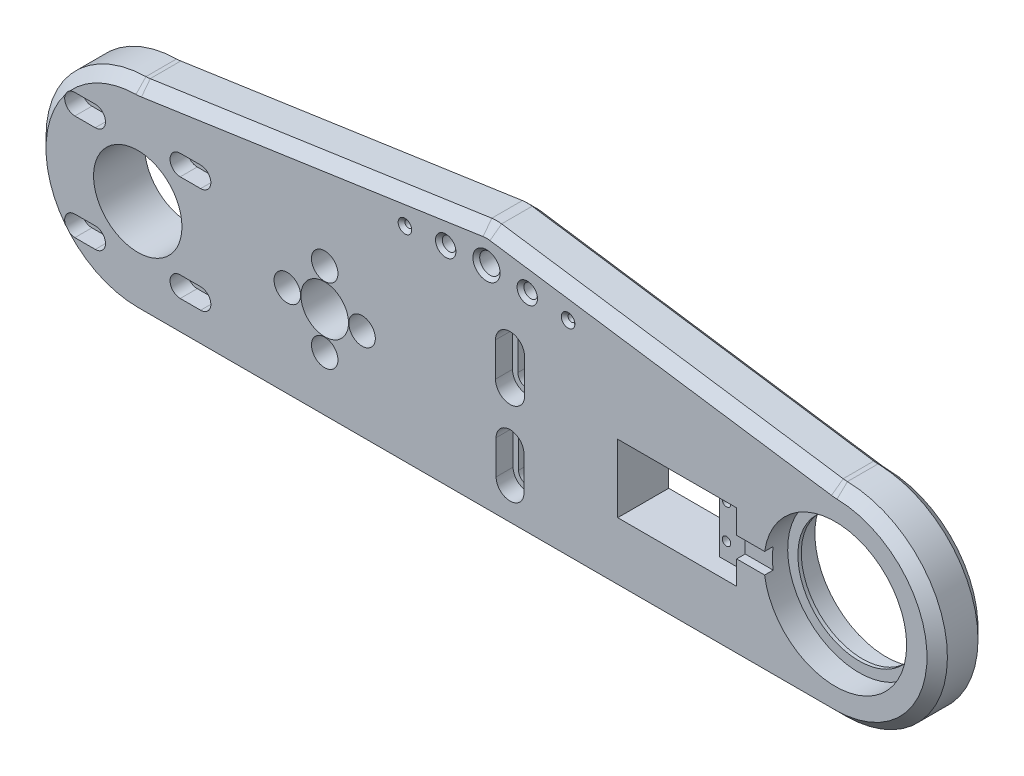
from build123d import *

# Parameters (mm, degrees)
SKETCH3_R                = 2.25
SKETCH3_R_2              = 7
SKETCH3_R_3              = 13
SKETCH3_R_4              = 21
SKETCH3_W                = 35
SKETCH3_H                = 20
BOSS_EXTRUDE1_DEPTH      = 7.5
SKETCH4_R                = 21
SKETCH4_R_2              = 18
BOSS_EXTRUDE2_DEPTH      = 0.5
SKETCH5_W                = 10
SKETCH5_H                = 20
SKETCH5_R                = 1.25
BOSS_EXTRUDE3_DEPTH      = 2.5
SKETCH6_R                = 3
SKETCH6_R_2              = 2
SKETCH6_R_3              = 4
BOSS_EXTRUDE4_DEPTH      = 7.5
FILLET1_R                = 10
SKETCH7_R                = 2
SKETCH7_R_2              = 3
SKETCH7_R_3              = 4
CUT_EXTRUDE1_DEPTH       = 1
CHAMFER1_SIZE            = 1
CHAMFER1_OF_MIRROR1_SIZE = 1
CHAMFER2_SIZE            = 3
CUT_EXTRUDE2_DEPTH       = 240.935187209
SKETCH10_R               = 3
SKETCH10_R_2             = 2
SKETCH10_R_3             = 1
CUT_EXTRUDE3_DEPTH       = 240.935187209
CUT_EXTRUDE4_DEPTH       = 5
CUT_EXTRUDE5_START       = -5
CUT_EXTRUDE5_DEPTH       = 5
SKETCH21_R               = 3.9
CUT_EXTRUDE6_DEPTH       = 6
CUT_EXTRUDE7_START       = -6
SKETCH22_R               = 3.9
CUT_EXTRUDE7_DEPTH       = 6
CUT_EXTRUDE10_DEPTH      = 5
CUT_EXTRUDE11_START      = -5
CUT_EXTRUDE11_DEPTH      = 5
SKETCH27_R               = 2.59
CUT_EXTRUDE13_DEPTH      = 3
SKETCH28_W               = 9
SKETCH28_H               = 6
CUT_EXTRUDE14_DEPTH      = 2.5


with BuildPart() as part:
    # Sketch3 → Boss-Extrude1 (new, symmetric)
    with BuildSketch(Plane.XY):
        with BuildLine():
            Line((0, -30), (205.22, -30))
            ThreePointArc((205.22, -30), (235.22, 0), (205.22, 30))
            Line((205.22, 30), (0, 30))
            ThreePointArc((0, 30), (-30, 0), (0, -30))
        make_face()
        with Locations((55, -11)):
            Circle(SKETCH3_R, mode=Mode.SUBTRACT)
        with Locations((66, 0)):
            Circle(SKETCH3_R, mode=Mode.SUBTRACT)
        with Locations((44, 0)):
            Circle(SKETCH3_R, mode=Mode.SUBTRACT)
        with Locations((55, 0)):
            Circle(SKETCH3_R_2, mode=Mode.SUBTRACT)
        with Locations((55, 11)):
            Circle(SKETCH3_R, mode=Mode.SUBTRACT)
        Circle(SKETCH3_R_3, mode=Mode.SUBTRACT)
        with Locations((205.22, 0)):
            Circle(SKETCH3_R_4, mode=Mode.SUBTRACT)
        with Locations((158.72, 0)):
            Rectangle(SKETCH3_W, SKETCH3_H, mode=Mode.SUBTRACT)
        with BuildLine():
            Line((-18.5, 17.3), (-12.5, 17.3))
            ThreePointArc((-12.5, 17.3), (-10.7, 15.5), (-12.5, 13.7))
            Line((-12.5, 13.7), (-18.5, 13.7))
            ThreePointArc((-18.5, 13.7), (-20.3, 15.5), (-18.5, 17.3))
        make_face(mode=Mode.SUBTRACT)
        with BuildLine():
            Line((12.5, 17.3), (18.5, 17.3))
            ThreePointArc((18.5, 17.3), (20.3, 15.5), (18.5, 13.7))
            Line((18.5, 13.7), (12.5, 13.7))
            ThreePointArc((12.5, 13.7), (10.7, 15.5), (12.5, 17.3))
        make_face(mode=Mode.SUBTRACT)
        with BuildLine():
            Line((-18.5, -13.7), (-12.5, -13.7))
            ThreePointArc((-12.5, -13.7), (-10.7, -15.5), (-12.5, -17.3))
            Line((-12.5, -17.3), (-18.5, -17.3))
            ThreePointArc((-18.5, -17.3), (-20.3, -15.5), (-18.5, -13.7))
        make_face(mode=Mode.SUBTRACT)
        with BuildLine():
            Line((12.5, -13.7), (18.5, -13.7))
            ThreePointArc((18.5, -13.7), (20.3, -15.5), (18.5, -17.3))
            Line((18.5, -17.3), (12.5, -17.3))
            ThreePointArc((12.5, -17.3), (10.7, -15.5), (12.5, -13.7))
        make_face(mode=Mode.SUBTRACT)
    extrude(amount=BOSS_EXTRUDE1_DEPTH, both=True)

    # Sketch4 → Boss-Extrude2 (add, symmetric)
    with BuildSketch(Plane.XY):
        with Locations((205.22, 0)):
            Circle(SKETCH4_R)
        with Locations((205.22, 0)):
            Circle(SKETCH4_R_2, mode=Mode.SUBTRACT)
    extrude(amount=BOSS_EXTRUDE2_DEPTH, both=True)

    # Sketch5 → Boss-Extrude3 (add, symmetric)
    with BuildSketch(Plane.XY):
        with Locations((171.22, 0)):
            Rectangle(SKETCH5_W, SKETCH5_H)
        with Locations((168.22, -5)):
            Circle(SKETCH5_R, mode=Mode.SUBTRACT)
        with Locations((168.22, 5)):
            Circle(SKETCH5_R, mode=Mode.SUBTRACT)
    extrude(amount=BOSS_EXTRUDE3_DEPTH, both=True)

    # Sketch6 → Boss-Extrude4 (add, symmetric)
    # profile 1 of 6: a face of its own
    with BuildSketch(Plane.XY):
        Polygon((205.22, 30), (0, 30), (102.61, 45), align=None)
        with Locations((114.61, 34)):
            Circle(SKETCH6_R, mode=Mode.SUBTRACT)
        with Locations((78.61, 33)):
            Circle(SKETCH6_R_2, mode=Mode.SUBTRACT)
        with Locations((90.61, 34)):
            Circle(SKETCH6_R, mode=Mode.SUBTRACT)
        with Locations((102.61, 35)):
            Circle(SKETCH6_R_3, mode=Mode.SUBTRACT)
        with Locations((126.61, 33)):
            Circle(SKETCH6_R_2, mode=Mode.SUBTRACT)
    # profile 2 of 6: a face of its own
    with BuildSketch(Plane.XY):
        with Locations((78.61, 33)):
            Circle(SKETCH6_R_2)
    # profile 3 of 6: a face of its own
    with BuildSketch(Plane.XY):
        with Locations((90.61, 34)):
            Circle(SKETCH6_R)
    # profile 4 of 6: a face of its own
    with BuildSketch(Plane.XY):
        with Locations((126.61, 33)):
            Circle(SKETCH6_R_2)
    # profile 5 of 6: a face of its own
    with BuildSketch(Plane.XY):
        with Locations((114.61, 34)):
            Circle(SKETCH6_R)
    # profile 6 of 6: a face of its own
    with BuildSketch(Plane.XY):
        with Locations((102.61, 35)):
            Circle(SKETCH6_R_3)
    extrude(amount=BOSS_EXTRUDE4_DEPTH, both=True)

    # Fillet1
    fillet1_edges = [part.edges().sort_by_distance(p)[0] for p in [
        (102.61, 45, 0),
        (0, 30, 0),
        (205.22, 30, 0),
    ]]
    fillet(fillet1_edges, radius=FILLET1_R)

    # Sketch7 → Cut-Extrude1 (cut)
    with BuildSketch(Plane.XY.offset(7.5)):
        with Locations((126.61, 33)):
            Circle(SKETCH7_R)
        with Locations((114.61, 34)):
            Circle(SKETCH7_R_2)
        with Locations((102.61, 35)):
            Circle(SKETCH7_R_3)
        with Locations((90.61, 34)):
            Circle(SKETCH7_R_2)
        with Locations((78.61, 33)):
            Circle(SKETCH7_R)
    cut_extrude1 = extrude(amount=-CUT_EXTRUDE1_DEPTH, mode=Mode.SUBTRACT)

    # Chamfer1
    chamfer1_edges = [part.edges().sort_by_distance(p)[0] for p in [
        (124.61, 33, 6.5),
        (111.61, 34, 6.5),
        (98.61, 35, 6.5),
        (87.61, 34, 6.5),
        (76.61, 33, 6.5),
    ]]
    chamfer(chamfer1_edges, length=CHAMFER1_SIZE - 0.0001)  # a hair under: the kernel refuses the full size

    # Mirror1: Cut-Extrude1 across plane
    add(cut_extrude1.mirror(Plane.XY), mode=Mode.SUBTRACT)

    # Chamfer1 of Mirror1
    chamfer1_of_mirror1_edges = [part.edges().sort_by_distance(p)[0] for p in [
        (124.61, 33, -6.5),
        (111.61, 34, -6.5),
        (98.61, 35, -6.5),
        (87.61, 34, -6.5),
        (76.61, 33, -6.5),
    ]]
    chamfer(chamfer1_of_mirror1_edges, length=CHAMFER1_OF_MIRROR1_SIZE - 0.0001)  # a hair under: the kernel refuses the full size

    # Chamfer2
    chamfer2_edges = [part.edges().sort_by_distance(p)[0] for p in [
        (154.30447348, 37.443064982, -7.5),
        (154.30447348, 37.443064982, 7.5),
        (50.91552652, 37.443064982, -7.5),
        (50.91552652, 37.443064982, 7.5),
        (-29.998577742, -0.292118959, -7.5),
        (102.61, 44.893715163, -7.5),
        (-29.998577742, -0.292118959, 7.5),
        (102.61, 44.893715163, 7.5),
        (205.176719643, 30.026275015, -7.5),
        (205.176719643, 30.026275015, 7.5),
        (0.043280357, 30.026275015, -7.5),
        (0.043280357, 30.026275015, 7.5),
        (102.61, -30, 7.5),
        (235.218577742, -0.292118959, 7.5),
        (102.61, -30, -7.5),
        (235.218577742, -0.292118959, -7.5),
    ]]
    chamfer(chamfer2_edges, length=CHAMFER2_SIZE)

    # Sketch9 → Cut-Extrude2 (cut, through all)
    with BuildSketch(Plane.XY.offset(7.5)):
        with BuildLine():
            Line((106.848526844, 17.312272335), (106.848526844, 7.312272335))
            ThreePointArc((106.848526844, 7.312272335), (109.536254509, 4.62454467), (112.223982174, 7.312272335))
            Line((112.223982174, 7.312272335), (112.223982174, 17.312272335))
            ThreePointArc((112.223982174, 17.312272335), (109.536254509, 20), (106.848526844, 17.312272335))
        make_face()
        with BuildLine():
            Line((107.036254509, -7.5), (107.036254509, -17.5))
            ThreePointArc((107.036254509, -17.5), (109.536254509, -20), (112.036254509, -17.5))
            Line((112.036254509, -17.5), (112.036254509, -7.5))
            ThreePointArc((112.036254509, -7.5), (109.536254509, -5), (107.036254509, -7.5))
        make_face()
    extrude(amount=-CUT_EXTRUDE2_DEPTH, mode=Mode.SUBTRACT)

    # Sketch10 → Cut-Extrude3 (cut, through all)
    with BuildSketch(Plane.XY.offset(7.5)):
        with Locations((102.61, 35)):
            Circle(SKETCH10_R)
        with Locations((114.61, 34)):
            Circle(SKETCH10_R_2)
        with Locations((90.61, 34)):
            Circle(SKETCH10_R_2)
        with Locations((126.61, 33)):
            Circle(SKETCH10_R_3)
        with Locations((78.61, 33)):
            Circle(SKETCH10_R_3)
    extrude(amount=-CUT_EXTRUDE3_DEPTH, mode=Mode.SUBTRACT)

    # Sketch19 → Cut-Extrude4 (cut)
    # profile 1 of 4: a face of its own
    with BuildSketch(Plane.XY.offset(7.5)):
        with BuildLine():
            Line((-18.5, 18.5), (-12.5, 18.5))
            ThreePointArc((-12.5, 18.5), (-9.5, 15.5), (-12.5, 12.5))
            Line((-12.5, 12.5), (-18.5, 12.5))
            ThreePointArc((-18.5, 12.5), (-21.5, 15.5), (-18.5, 18.5))
        make_face()
        with BuildLine():
            Line((-18.5, 17.3), (-12.5, 17.3))
            ThreePointArc((-12.5, 17.3), (-10.7, 15.5), (-12.5, 13.7))
            Line((-12.5, 13.7), (-18.5, 13.7))
            ThreePointArc((-18.5, 13.7), (-20.3, 15.5), (-18.5, 17.3))
        make_face(mode=Mode.SUBTRACT)
    # profile 2 of 4: a face of its own
    with BuildSketch(Plane.XY.offset(7.5)):
        with BuildLine():
            Line((12.5, 12.5), (18.5, 12.5))
            ThreePointArc((18.5, 12.5), (21.5, 15.5), (18.5, 18.5))
            Line((18.5, 18.5), (12.5, 18.5))
            ThreePointArc((12.5, 18.5), (9.5, 15.5), (12.5, 12.5))
        make_face()
        with BuildLine():
            Line((12.5, 17.3), (18.5, 17.3))
            ThreePointArc((18.5, 17.3), (20.3, 15.5), (18.5, 13.7))
            Line((18.5, 13.7), (12.5, 13.7))
            ThreePointArc((12.5, 13.7), (10.7, 15.5), (12.5, 17.3))
        make_face(mode=Mode.SUBTRACT)
    # profile 3 of 4: a face of its own
    with BuildSketch(Plane.XY.offset(7.5)):
        with BuildLine():
            Line((-18.5, -18.5), (-12.5, -18.5))
            ThreePointArc((-12.5, -18.5), (-9.5, -15.5), (-12.5, -12.5))
            Line((-12.5, -12.5), (-18.5, -12.5))
            ThreePointArc((-18.5, -12.5), (-21.5, -15.5), (-18.5, -18.5))
        make_face()
        with BuildLine():
            Line((-18.5, -13.7), (-12.5, -13.7))
            ThreePointArc((-12.5, -13.7), (-10.7, -15.5), (-12.5, -17.3))
            Line((-12.5, -17.3), (-18.5, -17.3))
            ThreePointArc((-18.5, -17.3), (-20.3, -15.5), (-18.5, -13.7))
        make_face(mode=Mode.SUBTRACT)
    # profile 4 of 4: a face of its own
    with BuildSketch(Plane.XY.offset(7.5)):
        with BuildLine():
            Line((12.5, -18.5), (18.5, -18.5))
            ThreePointArc((18.5, -18.5), (21.5, -15.5), (18.5, -12.5))
            Line((18.5, -12.5), (12.5, -12.5))
            ThreePointArc((12.5, -12.5), (9.5, -15.5), (12.5, -18.5))
        make_face()
        with BuildLine():
            Line((12.5, -13.7), (18.5, -13.7))
            ThreePointArc((18.5, -13.7), (20.3, -15.5), (18.5, -17.3))
            Line((18.5, -17.3), (12.5, -17.3))
            ThreePointArc((12.5, -17.3), (10.7, -15.5), (12.5, -13.7))
        make_face(mode=Mode.SUBTRACT)
    extrude(amount=-CUT_EXTRUDE4_DEPTH, mode=Mode.SUBTRACT)

    # Sketch20 → Cut-Extrude5 (cut)
    # profile 1 of 4: a face of its own
    with BuildSketch(Plane(origin=(0, 0, -7.5), x_dir=(-1, 0, 0), z_dir=(0, 0, -1)).offset(CUT_EXTRUDE5_START)):
        with BuildLine():
            Line((-18.5, 12.5), (-12.5, 12.5))
            ThreePointArc((-12.5, 12.5), (-9.5, 15.5), (-12.5, 18.5))
            Line((-12.5, 18.5), (-18.5, 18.5))
            ThreePointArc((-18.5, 18.5), (-21.5, 15.5), (-18.5, 12.5))
        make_face()
        with BuildLine():
            Line((-18.5, 17.3), (-12.5, 17.3))
            ThreePointArc((-12.5, 17.3), (-10.7, 15.5), (-12.5, 13.7))
            Line((-12.5, 13.7), (-18.5, 13.7))
            ThreePointArc((-18.5, 13.7), (-20.3, 15.5), (-18.5, 17.3))
        make_face(mode=Mode.SUBTRACT)
    # profile 2 of 4: a face of its own
    with BuildSketch(Plane(origin=(0, 0, -7.5), x_dir=(-1, 0, 0), z_dir=(0, 0, -1)).offset(CUT_EXTRUDE5_START)):
        with BuildLine():
            Line((12.5, 12.5), (18.5, 12.5))
            ThreePointArc((18.5, 12.5), (21.5, 15.5), (18.5, 18.5))
            Line((18.5, 18.5), (12.5, 18.5))
            ThreePointArc((12.5, 18.5), (9.5, 15.5), (12.5, 12.5))
        make_face()
        with BuildLine():
            Line((12.5, 17.3), (18.5, 17.3))
            ThreePointArc((18.5, 17.3), (20.3, 15.5), (18.5, 13.7))
            Line((18.5, 13.7), (12.5, 13.7))
            ThreePointArc((12.5, 13.7), (10.7, 15.5), (12.5, 17.3))
        make_face(mode=Mode.SUBTRACT)
    # profile 3 of 4: a face of its own
    with BuildSketch(Plane(origin=(0, 0, -7.5), x_dir=(-1, 0, 0), z_dir=(0, 0, -1)).offset(CUT_EXTRUDE5_START)):
        with BuildLine():
            Line((-18.5, -12.5), (-12.5, -12.5))
            ThreePointArc((-12.5, -12.5), (-9.5, -15.5), (-12.5, -18.5))
            Line((-12.5, -18.5), (-18.5, -18.5))
            ThreePointArc((-18.5, -18.5), (-21.5, -15.5), (-18.5, -12.5))
        make_face()
        with BuildLine():
            Line((-18.5, -13.7), (-12.5, -13.7))
            ThreePointArc((-12.5, -13.7), (-10.7, -15.5), (-12.5, -17.3))
            Line((-12.5, -17.3), (-18.5, -17.3))
            ThreePointArc((-18.5, -17.3), (-20.3, -15.5), (-18.5, -13.7))
        make_face(mode=Mode.SUBTRACT)
    # profile 4 of 4: a face of its own
    with BuildSketch(Plane(origin=(0, 0, -7.5), x_dir=(-1, 0, 0), z_dir=(0, 0, -1)).offset(CUT_EXTRUDE5_START)):
        with BuildLine():
            Line((12.5, -18.5), (18.5, -18.5))
            ThreePointArc((18.5, -18.5), (21.5, -15.5), (18.5, -12.5))
            Line((18.5, -12.5), (12.5, -12.5))
            ThreePointArc((12.5, -12.5), (9.5, -15.5), (12.5, -18.5))
        make_face()
        with BuildLine():
            Line((12.5, -13.7), (18.5, -13.7))
            ThreePointArc((18.5, -13.7), (20.3, -15.5), (18.5, -17.3))
            Line((18.5, -17.3), (12.5, -17.3))
            ThreePointArc((12.5, -17.3), (10.7, -15.5), (12.5, -13.7))
        make_face(mode=Mode.SUBTRACT)
    extrude(amount=CUT_EXTRUDE5_DEPTH, mode=Mode.SUBTRACT)

    # Sketch21 → Cut-Extrude6 (cut)
    with BuildSketch(Plane.XY.offset(7.5)):
        with Locations((55, 11)):
            Circle(SKETCH21_R)
        with Locations((55, -11)):
            Circle(SKETCH21_R)
        with Locations((44, 0)):
            Circle(SKETCH21_R)
        with Locations((66, 0)):
            Circle(SKETCH21_R)
    extrude(amount=-CUT_EXTRUDE6_DEPTH, mode=Mode.SUBTRACT)

    # Sketch22 → Cut-Extrude7 (cut)
    with BuildSketch(Plane(origin=(0, 0, -7.5), x_dir=(-1, 0, 0), z_dir=(0, 0, -1)).offset(CUT_EXTRUDE7_START)):
        with Locations(Location((-55, 11, 0), (0, 0, 180))):
            Circle(SKETCH22_R)
        with Locations(Location((-55, -11, 0), (0, 0, 180))):
            Circle(SKETCH22_R)
        with Locations(Location((-44, 0, 0), (0, 0, 180))):
            Circle(SKETCH22_R)
        with Locations(Location((-66, 0, 0), (0, 0, 180))):
            Circle(SKETCH22_R)
    extrude(amount=CUT_EXTRUDE7_DEPTH, mode=Mode.SUBTRACT)

    # Sketch23 → Cut-Extrude10 (cut)
    with BuildSketch(Plane.XY.offset(7.5)):
        with BuildLine():
            Line((113.823982174, 7.312272335), (113.823982174, 17.312272335))
            ThreePointArc((113.823982174, 17.312272335), (109.536254509, 21.6), (105.248526844, 17.312272335))
            Line((105.248526844, 17.312272335), (105.248526844, 7.312272335))
            ThreePointArc((105.248526844, 7.312272335), (109.536254509, 3.02454467), (113.823982174, 7.312272335))
        make_face()
        with BuildLine():
            Line((113.636254509, -17.5), (113.636254509, -7.5))
            ThreePointArc((113.636254509, -7.5), (109.536254509, -3.4), (105.436254509, -7.5))
            Line((105.436254509, -7.5), (105.436254509, -17.5))
            ThreePointArc((105.436254509, -17.5), (109.536254509, -21.6), (113.636254509, -17.5))
        make_face()
    extrude(amount=-CUT_EXTRUDE10_DEPTH, mode=Mode.SUBTRACT)

    # Sketch25 → Cut-Extrude11 (cut)
    with BuildSketch(Plane(origin=(0, 0, -7.5), x_dir=(-1, 0, 0), z_dir=(0, 0, -1)).offset(CUT_EXTRUDE11_START)):
        with BuildLine():
            Line((-113.823982174, 17.312272335), (-113.823982174, 7.312272335))
            ThreePointArc((-113.823982174, 7.312272335), (-109.536254509, 3.02454467), (-105.248526844, 7.312272335))
            Line((-105.248526844, 7.312272335), (-105.248526844, 17.312272335))
            ThreePointArc((-105.248526844, 17.312272335), (-109.536254509, 21.6), (-113.823982174, 17.312272335))
        make_face()
        with BuildLine():
            Line((-113.636254509, -7.5), (-113.636254509, -17.5))
            ThreePointArc((-113.636254509, -17.5), (-109.536254509, -21.6), (-105.436254509, -17.5))
            Line((-105.436254509, -17.5), (-105.436254509, -7.5))
            ThreePointArc((-105.436254509, -7.5), (-109.536254509, -3.4), (-113.636254509, -7.5))
        make_face()
    extrude(amount=CUT_EXTRUDE11_DEPTH, mode=Mode.SUBTRACT)

    # Sketch27 → Cut-Extrude13 (cut)
    with BuildSketch(Plane(origin=(0, 0, -7.5), x_dir=(-1, 0, 0), z_dir=(0, 0, -1))):
        with Locations((-23.8, 0)):
            Circle(SKETCH27_R)
    extrude(amount=-CUT_EXTRUDE13_DEPTH, mode=Mode.SUBTRACT)

    # Sketch28 → Cut-Extrude14 (cut)
    with BuildSketch(Plane.XY.offset(7.5)):
        with Locations((180.72, 0)):
            Rectangle(SKETCH28_W, SKETCH28_H)
    extrude(amount=-CUT_EXTRUDE14_DEPTH, mode=Mode.SUBTRACT)


solid = part.part
